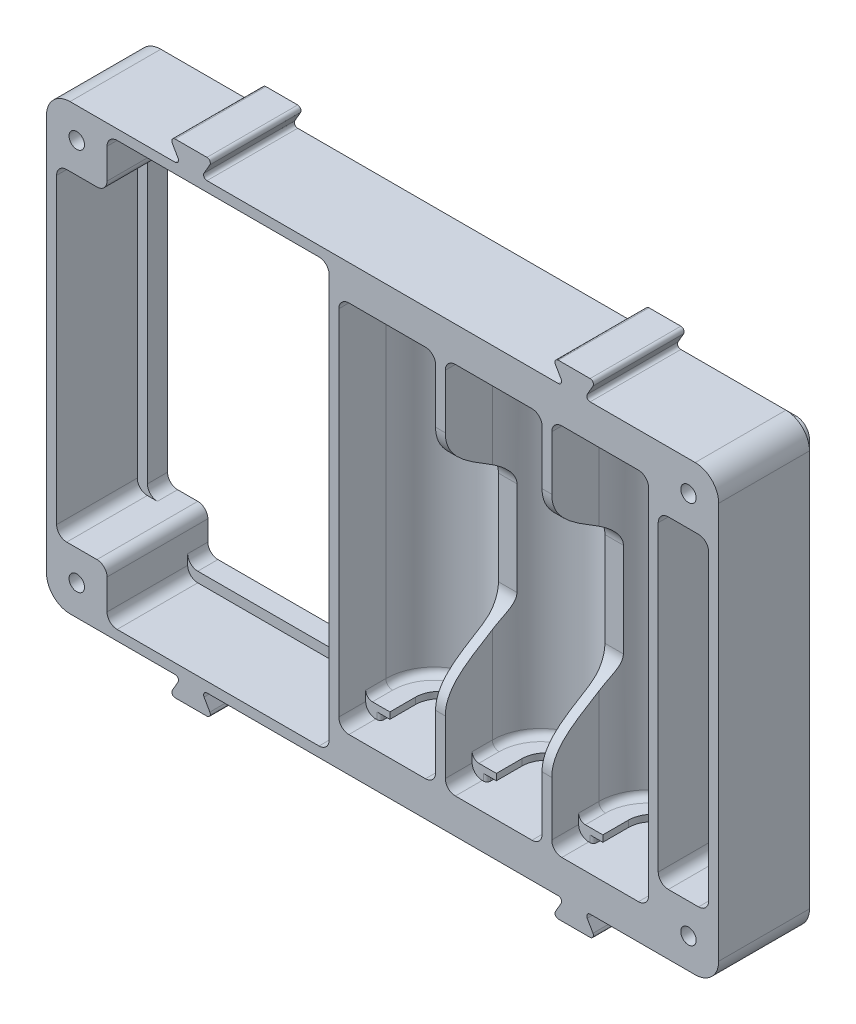
from build123d import *

# Parameters (mm, degrees)
BOSS_EXTRUDE1_DEPTH     = 27.8
SKETCH2_W               = 48.96
SKETCH2_H               = 15
BOSS_EXTRUDE2_DEPTH     = 1.44
CUT_EXTRUDE2_DEPTH      = 15
CUT_EXTRUDE2_DEPTH_BACK = 15
INNER_DEPTH             = 1
BOSS_EXTRUDE4_DEPTH     = 0.96
SKETCH5_W               = 3.4
SKETCH5_H               = 0.5
CUT_EXTRUDE1_DEPTH      = 41.978628576
SKETCH10_W              = 3.4
SKETCH10_H              = 1.94
CUT_EXTRUDE6_DEPTH      = 0.6
FILLET2_R               = 1.5
FILLET3_R               = 1
SKETCH_1_W              = 100
SKETCH_1_H              = 66
EXTRUDE_1_DEPTH         = 15
SKETCH_2_W              = 48.96
SKETCH_2_H              = 1.5
SKETCH_2_W_2            = 33.04
SKETCH_2_W_3            = 1.5
SKETCH_2_H_2            = 48
EXTRUDE_2_DEPTH         = 3
FILLET_6_R              = 3.5
HOLE_WIZARD_M2_22_D     = 2.3
HOLE_WIZARD_M2_22_DEPTH = 4
HOLE_WIZARD_M2_22_TIP   = 0.690989712
CUT_EXTRUDE_START       = -1.5
CUT_EXTRUDE_1_DEPTH     = 1.5
HOLE_WIZARD_M2_24_D     = 2.3
HOLE_WIZARD_M2_24_DEPTH = 3.309010288
HOLE_WIZARD_M2_24_TIP   = 0.690989712
FILLET_7_R              = 1.5
EXTRUDE_3_DEPTH         = 13.5
FILLET_8_R              = 0.5


with BuildPart() as part:
    # Sketch1 → Boss-Extrude1 (new body)
    with BuildSketch(Plane(origin=(0, 0, 0), x_dir=(1, 0, 0), z_dir=(0, 1, 0))):
        with BuildLine():
            Line((-24.48, 0), (24.48, 0))
            Line((24.48, 0), (24.48, -15))
            Line((24.48, -15), (23.04, -15))
            Line((23.04, -15), (23.04, -8))
            ThreePointArc((23.04, -8), (15.84, -0.8), (8.64, -8))
            Line((8.64, -8), (8.64, -15))
            Line((8.64, -15), (7.2, -15))
            Line((7.2, -15), (7.2, -8))
            ThreePointArc((7.2, -8), (0, -0.8), (-7.2, -8))
            Line((-7.2, -8), (-7.2, -15))
            Line((-7.2, -15), (-8.64, -15))
            Line((-8.64, -15), (-8.64, -8))
            ThreePointArc((-8.64, -8), (-15.84, -0.8), (-23.04, -8))
            Line((-23.04, -8), (-23.04, -15))
            Line((-23.04, -15), (-24.48, -15))
            Line((-24.48, -15), (-24.48, 0))
        make_face()
    extrude(amount=BOSS_EXTRUDE1_DEPTH)

    # Sketch2 → Boss-Extrude2 (add)
    with BuildSketch(Plane.XZ.offset(-27.8)):
        with Locations((0, 7.5)):
            Rectangle(SKETCH2_W, SKETCH2_H)
    extrude(amount=-BOSS_EXTRUDE2_DEPTH)

    # Sketch6 → Cut-Extrude2 (cut, two sides: drawn at the far end of the back side and taken through both)
    with BuildSketch(Plane(origin=(0, 0, 0), x_dir=(0, 0, -1), z_dir=(1, 0, 0)).offset(-CUT_EXTRUDE2_DEPTH_BACK)):
        with BuildLine():
            Line((-5, 0), (-15, 0))
            Line((-15, 0), (-15, 18.24))
            add(Edge.make_bspline(
                [(-15, 18.24), (-15, 12.24), (-5, 11), (-5, 7)],
                knots=[0, 0, 0, 0, 1, 1, 1, 1], degree=3))
            Line((-5, 7), (-5, 0))
        make_face()
    extrude(amount=CUT_EXTRUDE2_DEPTH + CUT_EXTRUDE2_DEPTH_BACK, mode=Mode.SUBTRACT)

    # Sketch3 → Inner (add)
    with BuildSketch(Plane.XZ.offset(-27.8)):
        with BuildLine():
            Line((-10.34, 11), (-8.64, 11))
            Line((-8.64, 11), (-8.64, 0))
            Line((-8.64, 0), (-23.04, 0))
            Line((-23.04, 0), (-23.04, 11))
            Line((-23.04, 11), (-21.34, 11))
            ThreePointArc((-21.34, 11), (-20.986446609, 10.853553391), (-20.84, 10.5))
            Line((-20.84, 10.5), (-20.84, 3.4))
            ThreePointArc((-20.84, 3.4), (-20.693553391, 3.046446609), (-20.34, 2.9))
            Line((-20.34, 2.9), (-11.34, 2.9))
            ThreePointArc((-11.34, 2.9), (-10.986446609, 3.046446609), (-10.84, 3.4))
            Line((-10.84, 3.4), (-10.84, 10.5))
            ThreePointArc((-10.84, 10.5), (-10.693553391, 10.853553391), (-10.34, 11))
        make_face()
    inner = extrude(amount=INNER_DEPTH)

    # Sketch4 → Boss-Extrude4 (add)
    with BuildSketch(Plane.XZ.offset(-26.8)):
        with BuildLine():
            Line((-8.64, 11), (-8.64, 0))
            Line((-8.64, 0), (-23.04, 0))
            Line((-23.04, 0), (-23.04, 11))
            Line((-23.04, 11), (-19.44, 11))
            Line((-19.44, 11), (-19.44, 7.2))
            ThreePointArc((-19.44, 7.2), (-15.84, 3.6), (-12.24, 7.2))
            Line((-12.24, 7.2), (-12.24, 11))
            Line((-12.24, 11), (-8.64, 11))
        make_face()
    boss_extrude4 = extrude(amount=BOSS_EXTRUDE4_DEPTH)

    # Sketch5 → Cut-Extrude1 (cut, through all)
    with BuildSketch(Plane.XY.offset(15)):
        with Locations((-15.84, 27.55)):
            Rectangle(SKETCH5_W, SKETCH5_H)
    cut_extrude1 = extrude(amount=-CUT_EXTRUDE1_DEPTH, mode=Mode.SUBTRACT)

    # Sketch10 → Cut-Extrude6 (cut)
    with BuildSketch(Plane.XY):
        with Locations((-15.84, 28.27)):
            Rectangle(SKETCH10_W, SKETCH10_H)
    cut_extrude6 = extrude(amount=CUT_EXTRUDE6_DEPTH, mode=Mode.SUBTRACT)

    # Mirror1: Inner, Boss-Extrude4, Cut-Extrude1, Cut-Extrude6 across plane
    add(inner.mirror(Plane(origin=(0, 0, 0), x_dir=(0, 0, 1), z_dir=(1, 0, 0))))
    add(boss_extrude4.mirror(Plane(origin=(0, 0, 0), x_dir=(0, 0, 1), z_dir=(1, 0, 0))))
    add(cut_extrude1.mirror(Plane(origin=(0, 0, 0), x_dir=(0, 0, 1), z_dir=(1, 0, 0))), mode=Mode.SUBTRACT)
    add(cut_extrude6.mirror(Plane(origin=(0, 0, 0), x_dir=(0, 0, 1), z_dir=(1, 0, 0))), mode=Mode.SUBTRACT)

    # Mirror2: Inner, Boss-Extrude4, Cut-Extrude1, Cut-Extrude6 across plane
    add(inner.mirror(Plane(origin=(-7.92, 0, 0), x_dir=(0, 0, 1), z_dir=(1, 0, 0))))
    add(boss_extrude4.mirror(Plane(origin=(-7.92, 0, 0), x_dir=(0, 0, 1), z_dir=(1, 0, 0))))
    add(cut_extrude1.mirror(Plane(origin=(-7.92, 0, 0), x_dir=(0, 0, 1), z_dir=(1, 0, 0))), mode=Mode.SUBTRACT)
    add(cut_extrude6.mirror(Plane(origin=(-7.92, 0, 0), x_dir=(0, 0, 1), z_dir=(1, 0, 0))), mode=Mode.SUBTRACT)

    # Fillet2
    fillet2_edges = [part.edges().sort_by_distance(p)[0] for p in [
        (-8.64, 27.8, 13),
        (-23.04, 27.8, 13),
        (23.04, 27.8, 13),
        (-7.2, 27.8, 13),
        (7.2, 27.8, 13),
        (8.64, 27.8, 13),
    ]]
    fillet(fillet2_edges, radius=FILLET2_R)

    # Fillet3
    fillet3_edges = [part.edges().sort_by_distance(p)[0] for p in [
        (-8.64, 25.84, 9.5),
        (-23.04, 25.84, 9.5),
        (-15.84, 25.84, 0.8),
        (8.64, 25.84, 9.5),
        (23.04, 25.84, 9.5),
        (15.84, 25.84, 0.8),
        (-7.2, 25.84, 9.5),
        (7.2, 25.84, 9.5),
        (0, 25.84, 0.8),
    ]]
    fillet(fillet3_edges, radius=FILLET3_R)

    # Mirror4: part across plane


with BuildPart() as part_1:
    add(part.part)
    add(part.part.mirror(Plane.ZX))

    # Эскиз1 → Бобышка-Вытянуть1 (add)
    with BuildSketch(Plane(origin=(0, 0, 0), x_dir=(-1, 0, 0), z_dir=(0, 0, -1))):
        with Locations((16.52, 0)):
            Rectangle(SKETCH_1_W, SKETCH_1_H)
        Polygon((-24.48, -29.24), (-24.48, -24), (-31.98, -24), (-31.98, 24), (-24.48, 24), (-24.48, 29.24), (24.48, 29.24), (24.48, 31.5), (57.52, 31.5), (57.52, 24), (65.02, 24), (65.02, -24), (57.52, -24), (57.52, -31.5), (24.48, -31.5), (24.48, -29.24), align=None, mode=Mode.SUBTRACT)
    extrude(amount=-EXTRUDE_1_DEPTH)

    # Эскиз2 → Бобышка-Вытянуть2 (add)
    with BuildSketch(Plane(origin=(0, 0, 0), x_dir=(-1, 0, 0), z_dir=(0, 0, -1))):
        Polygon((-31.98, 31.5), (-31.98, 24), (-30.48, 24), (-24.48, 24), (-24.48, 30), (-24.48, 31.5), align=None)
        with Locations((0, 30.75)):
            Rectangle(SKETCH_2_W, SKETCH_2_H)
        with Locations((41, 30.75)):
            Rectangle(SKETCH_2_W_2, SKETCH_2_H)
        Polygon((57.52, 31.5), (57.52, 30), (57.52, 24), (63.52, 24), (65.02, 24), (65.02, 31.5), align=None)
        with Locations((64.27, 0)):
            Rectangle(SKETCH_2_W_3, SKETCH_2_H_2)
        Polygon((57.52, -30), (57.52, -31.5), (65.02, -31.5), (65.02, -24), (63.52, -24), (57.52, -24), align=None)
        with Locations((41, -30.75)):
            Rectangle(SKETCH_2_W_2, SKETCH_2_H)
        with Locations((0, -30.75)):
            Rectangle(SKETCH_2_W, SKETCH_2_H)
        Polygon((-31.98, -24), (-31.98, -31.5), (-24.48, -31.5), (-24.48, -30), (-24.48, -24), (-30.48, -24), align=None)
        with Locations((-31.23, 0)):
            Rectangle(SKETCH_2_W_3, SKETCH_2_H_2)
    extrude(amount=-EXTRUDE_2_DEPTH)

    # Скругление6
    fillet_6_edges = [part_1.edges().sort_by_distance(p)[0] for p in [
        (-66.52, -33, 7.5),
        (33.48, -33, 7.5),
        (33.48, 33, 7.5),
        (-66.52, 33, 7.5),
    ]]
    fillet(fillet_6_edges, radius=FILLET_6_R)

    # Сверло под метчик  спиральное M2.22
    with Locations(Plane.XY.offset(15)):
        with Locations((-62.02, 28.5), (28.98, 28.5), (28.98, -28.5), (-62.02, -28.5)):
            Hole(HOLE_WIZARD_M2_22_D / 2, depth=HOLE_WIZARD_M2_22_DEPTH)
            with Locations((0, 0, -(HOLE_WIZARD_M2_22_DEPTH + HOLE_WIZARD_M2_22_TIP / 2))):  # 118° drill point
                Cone(0, HOLE_WIZARD_M2_22_D / 2, HOLE_WIZARD_M2_22_TIP, mode=Mode.SUBTRACT)

    # Эскиз8 → Вырез-Вытянуть1 (cut)
    with BuildSketch(Plane(origin=(0, 0, 0), x_dir=(-1, 0, 0), z_dir=(0, 0, -1)).offset(CUT_EXTRUDE_START)):
        with BuildLine():
            Line((66.52, -29.5), (66.52, 29.5))
            ThreePointArc((66.52, 29.5), (65.494873734, 31.974873734), (63.02, 33))
            Line((63.02, 33), (-29.98, 33))
            ThreePointArc((-29.98, 33), (-32.454873734, 31.974873734), (-33.48, 29.5))
            Line((-33.48, 29.5), (-33.48, -29.5))
            ThreePointArc((-33.48, -29.5), (-32.454873734, -31.974873734), (-29.98, -33))
            Line((-29.98, -33), (63.02, -33))
            ThreePointArc((63.02, -33), (65.494873734, -31.974873734), (66.52, -29.5))
        make_face()
        with BuildLine():
            Line((65.02, -29.5), (65.02, 29.5))
            ThreePointArc((65.02, 29.5), (64.434213562, 30.914213562), (63.02, 31.5))
            Line((63.02, 31.5), (-29.98, 31.5))
            ThreePointArc((-29.98, 31.5), (-31.394213562, 30.914213562), (-31.98, 29.5))
            Line((-31.98, 29.5), (-31.98, -29.5))
            ThreePointArc((-31.98, -29.5), (-31.394213562, -30.914213562), (-29.98, -31.5))
            Line((-29.98, -31.5), (63.02, -31.5))
            ThreePointArc((63.02, -31.5), (64.434213562, -30.914213562), (65.02, -29.5))
        make_face(mode=Mode.SUBTRACT)
    extrude(amount=CUT_EXTRUDE_1_DEPTH, mode=Mode.SUBTRACT)

    # Сверло под метчик  спиральное M2.24
    with Locations(Plane(origin=(0, 0, 0), x_dir=(-1, 0, 0), z_dir=(0, 0, -1))):
        with Locations((-28.98, 28.5), (62.02, 28.5), (62.02, -28.5), (-28.98, -28.5)):
            Hole(HOLE_WIZARD_M2_24_D / 2, depth=HOLE_WIZARD_M2_24_DEPTH)
            with Locations((0, 0, -(HOLE_WIZARD_M2_24_DEPTH + HOLE_WIZARD_M2_24_TIP / 2))):  # 118° drill point
                Cone(0, HOLE_WIZARD_M2_24_D / 2, HOLE_WIZARD_M2_24_TIP, mode=Mode.SUBTRACT)

    # Скругление7
    fillet_7_edges = [part_1.edges().sort_by_distance(p)[0] for p in [
        (-24.48, -31.5, 9),
        (-24.48, -30, 1.5),
        (-57.52, -30, 1.5),
        (-57.52, -31.5, 9),
        (-57.52, -24, 7.5),
        (-24.48, 30, 1.5),
        (-24.48, 31.5, 9),
        (-57.52, 30, 1.5),
        (-57.52, 31.5, 9),
        (-57.52, 24, 7.5),
        (-63.52, 24, 1.5),
        (-65.02, 24, 9),
        (-63.52, -24, 1.5),
        (-65.02, -24, 9),
        (31.98, 24, 9),
        (31.98, -24, 9),
        (30.48, -24, 1.5),
        (24.48, -24, 7.5),
        (24.48, 24, 7.5),
        (30.48, 24, 1.5),
    ]]
    fillet(fillet_7_edges, radius=FILLET_7_R - 0.0001)  # a hair under: the kernel refuses the full size

    # Эскиз11 → Бобышка-Вытянуть3 (add)
    with BuildSketch(Plane.XY.offset(15)):
        Polygon((-46.52, 33), (-48.252050808, 36), (-41.787949192, 36), (-43.52, 33), align=None)
        Polygon((10.48, 33), (8.747949192, 36), (15.212050808, 36), (13.48, 33), align=None)
        Polygon((-46.52, -33), (-48.252050808, -36), (-41.787949192, -36), (-43.52, -33), align=None)
        Polygon((10.48, -33), (8.747949192, -36), (15.212050808, -36), (13.48, -33), align=None)
    extrude(amount=-EXTRUDE_3_DEPTH)

    # Скругление8
    fillet_8_edges = [part_1.edges().sort_by_distance(p)[0] for p in [
        (-43.52, 33, 8.25),
        (-46.52, 33, 8.25),
        (-48.252050808, 36, 8.25),
        (-41.787949192, 36, 8.25),
        (13.48, 33, 8.25),
        (10.48, 33, 8.25),
        (8.747949192, 36, 8.25),
        (15.212050808, 36, 8.25),
        (10.48, -33, 8.25),
        (13.48, -33, 8.25),
        (15.212050808, -36, 8.25),
        (8.747949192, -36, 8.25),
        (-43.52, -33, 8.25),
        (-41.787949192, -36, 8.25),
        (-48.252050808, -36, 8.25),
        (-46.52, -33, 8.25),
    ]]
    fillet(fillet_8_edges, radius=FILLET_8_R)


solid = part_1.part
